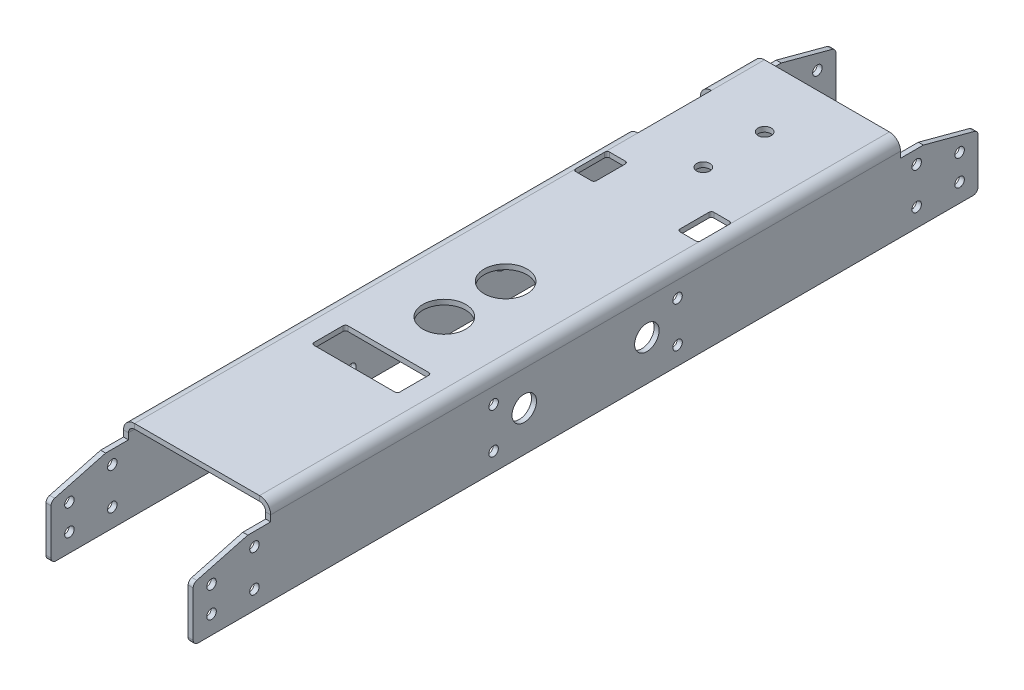
from build123d import *

# Parameters (mm, degrees)
BASE_FLANGE1_DEPTH           = 406.4
CUT_EXTRUDE1_DEPTH           = 416.864403983
F_1_4_CLEARANCE_HOLE1_D      = 6.858
F_10_0_1935_DIAMETER_HOLE1_D = 4.9149
SKETCH15_W                   = 10.69848
SKETCH15_H                   = 17.546986719
CUT_EXTRUDE4_DEPTH           = 411.595144272
SKETCH16_W                   = 44.45
SKETCH16_H                   = 17.546986719
CUT_EXTRUDE5_DEPTH           = 411.595144272
FILLET2_R                    = 1.27
F_1_2_0_5_DIAMETER_HOLE1_D   = 12.7
SKETCH19_W                   = 38.1
SKETCH19_H                   = 22.225
CUT_EXTRUDE6_DEPTH           = 5.76326
F_7_8_0_875_DIAMETER_HOLE1_D = 22.225
FILLET3_R                    = 2.54


# Sheet-metal steps are written as plain solids
with BuildPart() as part:
    # Sketch1 → Base-Flange1 (new body)
    with BuildSketch(Plane.XY):
        with BuildLine():
            Line((38.1, -44.45), (38.1, -5.76326))
            ThreePointArc((38.1, -5.76326), (36.411980228, -1.688019772), (32.33674, 0))
            Line((32.33674, 0), (-32.33674, 0))
            ThreePointArc((-32.33674, 0), (-36.411980228, -1.688019772), (-38.1, -5.76326))
            Line((-38.1, -5.76326), (-38.1, -44.45))
            Line((-38.1, -44.45), (-35.51174, -44.45))
            Line((-35.51174, -44.45), (-35.51174, -5.76326))
            ThreePointArc((-35.51174, -5.76326), (-34.58180403, -3.51819597), (-32.33674, -2.58826))
            Line((-32.33674, -2.58826), (32.33674, -2.58826))
            ThreePointArc((32.33674, -2.58826), (34.58180403, -3.51819597), (35.51174, -5.76326))
            Line((35.51174, -5.76326), (35.51174, -44.45))
            Line((35.51174, -44.45), (38.1, -44.45))
        make_face()
    extrude(amount=BASE_FLANGE1_DEPTH)

    # Sketch7 → Cut-Extrude1 (cut, through all)
    with BuildSketch(Plane(origin=(38.1, 0, 0), x_dir=(0, 0, -1), z_dir=(1, 0, 0))):
        Polygon((-406.4, -16.515725506), (-378.120513741, -8.93826), (-366.271252427, -8.93826), (-366.271252427, 0), (-406.4, 0), align=None)
        Polygon((0, 0), (0, -16.515725506), (-28.279486259, -8.93826), (-40.128747573, -8.93826), (-40.128747573, 0), align=None)
    extrude(amount=-CUT_EXTRUDE1_DEPTH, mode=Mode.SUBTRACT)

    # 1/4 Clearance Hole1 (through all)
    with Locations(Plane(origin=(0, 0, 0), x_dir=(1, 0, 0), z_dir=(0, 1, 0))):
        with Locations((0, -104.14), (0, -72.39)):
            Hole(F_1_4_CLEARANCE_HOLE1_D / 2)

    # #10 (0.1935) Diameter Hole1 (through all)
    with Locations(Plane.ZY.offset(38.1)):
        with Locations((9.525, -34.925), (9.525, -21.59), (31.75, -34.925), (31.75, -15.875), (374.65, -15.875), (374.65, -34.925), (396.875, -21.59), (396.875, -34.925), (155.575, -13.97), (155.575, -34.925), (250.825, -34.925), (250.825, -13.97)):
            Hole(F_10_0_1935_DIAMETER_HOLE1_D / 2)

    # Sketch15 → Cut-Extrude4 (cut, through all)
    with BuildSketch(Plane(origin=(0, 0, 0), x_dir=(1, 0, 0), z_dir=(0, 1, 0))):
        with Locations((26.9875, -130.37599336)):
            Rectangle(SKETCH15_W, SKETCH15_H)
        with Locations((-26.9875, -130.37599336)):
            Rectangle(SKETCH15_W, SKETCH15_H)
    extrude(amount=-CUT_EXTRUDE4_DEPTH, mode=Mode.SUBTRACT)

    # Sketch16 → Cut-Extrude5 (cut, through all)
    with BuildSketch(Plane(origin=(0, 0, 0), x_dir=(1, 0, 0), z_dir=(0, 1, 0))):
        with Locations((0, -276.024006641)):
            Rectangle(SKETCH16_W, SKETCH16_H)
    extrude(amount=-CUT_EXTRUDE5_DEPTH, mode=Mode.SUBTRACT)

    # Fillet2
    fillet2_edges = [part.edges().sort_by_distance(p)[0] for p in [
        (21.63826, -1.29413, 139.149486719),
        (21.63826, -1.29413, 121.6025),
        (32.33674, -1.29413, 121.6025),
        (32.33674, -1.29413, 139.149486719),
        (-32.33674, -1.29413, 121.6025),
        (-21.63826, -1.29413, 121.6025),
        (-21.63826, -1.29413, 139.149486719),
        (-32.33674, -1.29413, 139.149486719),
        (-22.225, -1.29413, 284.7975),
        (-22.225, -1.29413, 267.250513281),
        (22.225, -1.29413, 267.250513281),
        (22.225, -1.29413, 284.7975),
    ]]
    fillet(fillet2_edges, radius=FILLET2_R)

    # 1/2 (0.5) Diameter Hole1 (through all)
    with Locations(Plane.ZY.offset(38.1)):
        with Locations((171.45, -23.607014), (234.95, -23.607014)):
            Hole(F_1_2_0_5_DIAMETER_HOLE1_D / 2)

    # Sketch19 → Cut-Extrude6 (cut)
    with BuildSketch(Plane.ZY.offset(38.1)):
        with Locations((86.6775, -11.1125)):
            Rectangle(SKETCH19_W, SKETCH19_H)
    extrude(amount=-CUT_EXTRUDE6_DEPTH, mode=Mode.SUBTRACT)

    # 7/8 (0.875) Diameter Hole1 (through all)
    with Locations(Plane(origin=(0, 0, 0), x_dir=(1, 0, 0), z_dir=(0, 1, 0))):
        with Locations((0, -238.252), (0, -206.502)):
            Hole(F_7_8_0_875_DIAMETER_HOLE1_D / 2)

    # Fillet3
    fillet3_edges = [part.edges().sort_by_distance(p)[0] for p in [
        (36.80587, -16.515725506, 0),
        (-36.80587, -16.515725506, 0),
        (36.80587, -44.45, 0),
        (-36.80587, -44.45, 0),
        (36.80587, -44.45, 406.4),
        (-36.80587, -22.225, 67.6275),
        (-36.80587, -22.225, 105.7275),
        (-36.80587, -16.515725506, 406.4),
        (36.80587, -16.515725506, 406.4),
        (-36.80587, -44.45, 406.4),
    ]]
    fillet(fillet3_edges, radius=FILLET3_R)


solid = part.part
